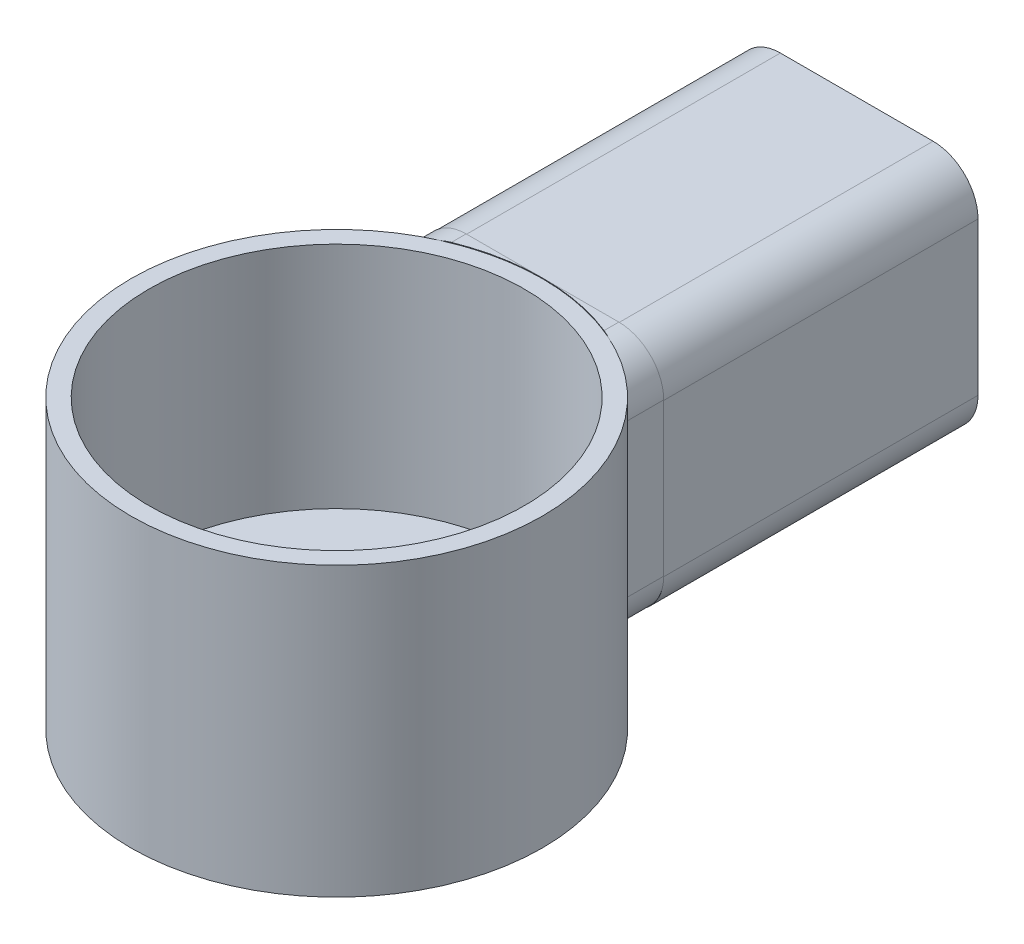
from build123d import *

# Parameters (mm, degrees)
BOSS_EXTRU_1_DEPTH      = 25
BOSS_EXTRU_2_DEPTH      = 10
ESQUISSE4_R             = 22.9
BOSS_EXTRU_3_DEPTH      = 32
BOSS_EXTRU_5_REACH      = 56.445
BOSS_EXTRU_5_END_RADIUS = 22.9
ESQUISSE6_R             = 20.9
ENL_V_MAT_EXTRU_1_DEPTH = 25.5
ESQUISSE8_R             = 2
ENL_V_MAT_EXTRU_3_DEPTH = 2.6
BOSS_EXTRU_6_START      = -25
BOSS_EXTRU_6_DEPTH      = 25


# Read off the part's stored shape, not the designer's step: Boss.-Extru.6
with BuildPart() as part:
    # Esquisse2 → Boss.-Extru.1 (new body)
    with BuildSketch(Plane.XY):
        with BuildLine():
            Line((13.5, 8.5), (13.5, -8.5))
            ThreePointArc((13.5, -8.5), (12.035533906, -12.035533906), (8.5, -13.5))
            Line((8.5, -13.5), (-8.5, -13.5))
            ThreePointArc((-8.5, -13.5), (-12.035533906, -12.035533906), (-13.5, -8.5))
            Line((-13.5, -8.5), (-13.5, 8.5))
            ThreePointArc((-13.5, 8.5), (-12.035533906, 12.035533906), (-8.5, 13.5))
            Line((-8.5, 13.5), (8.5, 13.5))
            ThreePointArc((8.5, 13.5), (12.035533906, 12.035533906), (13.5, 8.5))
        make_face()
        with BuildLine():
            Line((0, 4), (-0.866025404, 4.5))
            Line((-0.866025404, 4.5), (-3.439339828, 4.5))
            Line((-3.439339828, 4.5), (-6, 7.060660172))
            Line((-6, 7.060660172), (-6, 8.5))
            Line((-6, 8.5), (-3, 8.5))
            Line((-3, 8.5), (-3, 9.5))
            Line((-3, 9.5), (-3.5, 9.5))
            Line((-3.5, 9.5), (-3.5, 10))
            Line((-3.5, 10), (-8.5, 10))
            ThreePointArc((-8.5, 10), (-9.560660172, 9.560660172), (-10, 8.5))
            Line((-10, 8.5), (-10, 3.5))
            Line((-10, 3.5), (-9.5, 3.5))
            Line((-9.5, 3.5), (-9.5, 3))
            Line((-9.5, 3), (-8.5, 3))
            Line((-8.5, 3), (-8.5, 6))
            Line((-8.5, 6), (-7.060660172, 6))
            Line((-7.060660172, 6), (-4.5, 3.439339828))
            Line((-4.5, 3.439339828), (-4.5, 0.866025404))
            Line((-4.5, 0.866025404), (-4, 0))
            Line((-4, 0), (-4.5, -0.866025404))
            Line((-4.5, -0.866025404), (-4.5, -3.439339828))
            Line((-4.5, -3.439339828), (-7.060660172, -6))
            Line((-7.060660172, -6), (-8.5, -6))
            Line((-8.5, -6), (-8.5, -3))
            Line((-8.5, -3), (-9.5, -3))
            Line((-9.5, -3), (-9.5, -3.5))
            Line((-9.5, -3.5), (-10, -3.5))
            Line((-10, -3.5), (-10, -8.5))
            ThreePointArc((-10, -8.5), (-9.560660172, -9.560660172), (-8.5, -10))
            Line((-8.5, -10), (-3.5, -10))
            Line((-3.5, -10), (-3.5, -9.5))
            Line((-3.5, -9.5), (-3, -9.5))
            Line((-3, -9.5), (-3, -8.5))
            Line((-3, -8.5), (-6, -8.5))
            Line((-6, -8.5), (-6, -7.060660172))
            Line((-6, -7.060660172), (-3.439339828, -4.5))
            Line((-3.439339828, -4.5), (-0.866025404, -4.5))
            Line((-0.866025404, -4.5), (0, -4))
            Line((0, -4), (0.866025404, -4.5))
            Line((0.866025404, -4.5), (3.439339828, -4.5))
            Line((3.439339828, -4.5), (6, -7.060660172))
            Line((6, -7.060660172), (6, -8.5))
            Line((6, -8.5), (3, -8.5))
            Line((3, -8.5), (3, -9.5))
            Line((3, -9.5), (3.5, -9.5))
            Line((3.5, -9.5), (3.5, -10))
            Line((3.5, -10), (8.5, -10))
            ThreePointArc((8.5, -10), (9.560660172, -9.560660172), (10, -8.5))
            Line((10, -8.5), (10, -3.5))
            Line((10, -3.5), (9.5, -3.5))
            Line((9.5, -3.5), (9.5, -3))
            Line((9.5, -3), (8.5, -3))
            Line((8.5, -3), (8.5, -6))
            Line((8.5, -6), (7.060660172, -6))
            Line((7.060660172, -6), (4.5, -3.439339828))
            Line((4.5, -3.439339828), (4.5, -0.866025404))
            Line((4.5, -0.866025404), (4, 0))
            Line((4, 0), (4.5, 0.866025404))
            Line((4.5, 0.866025404), (4.5, 3.439339828))
            Line((4.5, 3.439339828), (7.060660172, 6))
            Line((7.060660172, 6), (8.5, 6))
            Line((8.5, 6), (8.5, 3))
            Line((8.5, 3), (9.5, 3))
            Line((9.5, 3), (9.5, 3.5))
            Line((9.5, 3.5), (10, 3.5))
            Line((10, 3.5), (10, 8.5))
            ThreePointArc((10, 8.5), (9.560660172, 9.560660172), (8.5, 10))
            Line((8.5, 10), (3.5, 10))
            Line((3.5, 10), (3.5, 9.5))
            Line((3.5, 9.5), (3, 9.5))
            Line((3, 9.5), (3, 8.5))
            Line((3, 8.5), (6, 8.5))
            Line((6, 8.5), (6, 7.060660172))
            Line((6, 7.060660172), (3.439339828, 4.5))
            Line((3.439339828, 4.5), (0.866025404, 4.5))
            Line((0.866025404, 4.5), (0, 4))
        make_face(mode=Mode.SUBTRACT)
    extrude(amount=BOSS_EXTRU_1_DEPTH)

    # Esquisse3 → Boss.-Extru.2 (add)
    with BuildSketch(Plane.XY.offset(25)):
        with BuildLine():
            Line((-8.5, 13.5), (8.5, 13.5))
            ThreePointArc((8.5, 13.5), (12.035533906, 12.035533906), (13.5, 8.5))
            Line((13.5, 8.5), (13.5, -8.5))
            ThreePointArc((13.5, -8.5), (12.035533906, -12.035533906), (8.5, -13.5))
            Line((8.5, -13.5), (-8.5, -13.5))
            ThreePointArc((-8.5, -13.5), (-12.035533906, -12.035533906), (-13.5, -8.5))
            Line((-13.5, -8.5), (-13.5, 8.5))
            ThreePointArc((-13.5, 8.5), (-12.035533906, 12.035533906), (-8.5, 13.5))
        make_face()
    extrude(amount=BOSS_EXTRU_2_DEPTH)

    # Boss.-Extru.6 outline → Boss.-Extru.6 (add)
    with BuildSketch(Plane(origin=(0, 0, 0), x_dir=(-1, 0, 0), z_dir=(0, 0, -1)).offset(BOSS_EXTRU_6_START)):
        with BuildLine():
            Line((-1.273167982, 2.43752811), (-1.947287092, 3.003181207))
            Line((-1.947287092, 3.003181207), (-3.000876196, 1.949592103))
            Line((-3.000876196, 1.949592103), (-2.435900169, 1.276279893))
            ThreePointArc((-2.435900169, 1.276279893), (-2.749999439, 0.001756003), (-2.43752811, -1.273167982))
            Line((-2.43752811, -1.273167982), (-3.003181207, -1.947287092))
            Line((-3.003181207, -1.947287092), (-1.949592103, -3.000876196))
            Line((-1.949592103, -3.000876196), (-1.276279893, -2.435900169))
            ThreePointArc((-1.276279893, -2.435900169), (-0.001756003, -2.749999439), (1.273167982, -2.43752811))
            Line((1.273167982, -2.43752811), (1.947287092, -3.003181207))
            Line((1.947287092, -3.003181207), (3.000876196, -1.949592103))
            Line((3.000876196, -1.949592103), (2.435900169, -1.276279893))
            ThreePointArc((2.435900169, -1.276279893), (2.749999439, -0.001756003), (2.43752811, 1.273167982))
            Line((2.43752811, 1.273167982), (3.003181207, 1.947287092))
            Line((3.003181207, 1.947287092), (1.949592103, 3.000876196))
            Line((1.949592103, 3.000876196), (1.276279893, 2.435900169))
            ThreePointArc((1.276279893, 2.435900169), (0.001756003, 2.749999439), (-1.273167982, 2.43752811))
        make_face()
    extrude(amount=BOSS_EXTRU_6_DEPTH)


with BuildPart() as body_2:
    # Esquisse4 → Boss.-Extru.3 (new body)
    with BuildSketch(Plane(origin=(0, 13.5, 0), x_dir=(1, 0, 0), z_dir=(0, 1, 0))):
        with Locations(Location((0, -57.9, 0), (0, 0, 180))):
            Circle(ESQUISSE4_R)
    extrude(amount=-BOSS_EXTRU_3_DEPTH)

    # Esquisse6 → Enlèv. mat.-Extru.1 (cut)
    with BuildSketch(Plane(origin=(0, 13.5, 0), x_dir=(1, 0, 0), z_dir=(0, 1, 0))):
        with Locations(Location((0, -57.9, 0), (0, 0, 180))):
            Circle(ESQUISSE6_R)
    extrude(amount=-ENL_V_MAT_EXTRU_1_DEPTH, mode=Mode.SUBTRACT)

    # Esquisse8 → Enlèv. mat.-Extru.3 (cut)
    with BuildSketch(Plane(origin=(0, -12, 0), x_dir=(1, 0, 0), z_dir=(0, 1, 0))):
        with Locations(Location((0, -57.9, 0), (0, 0, 180))):
            Circle(ESQUISSE8_R)
    extrude(amount=-ENL_V_MAT_EXTRU_3_DEPTH, mode=Mode.SUBTRACT)


with BuildPart() as body_3:
    # Boss.-Extru.5: up to this cylinder (the profile starts outside it)
    boss_extru_5_end = Plane(origin=(0, 0.068098, 57.9), z_dir=(0, 1, 0)) * Cylinder(BOSS_EXTRU_5_END_RADIUS, 159.69, mode=Mode.PRIVATE)
    # Esquisse5 → Boss.-Extru.5 (new, up to the surface)
    with BuildSketch(Plane.XY.offset(35), mode=Mode.PRIVATE) as boss_extru_5_sk1:
        with BuildLine():
            Line((-8.486380485, 13.568097576), (8.513619515, 13.568097576))
            ThreePointArc((8.513619515, 13.568097576), (12.049153421, 12.103631482), (13.513619515, 8.568097576))
            Line((13.513619515, 8.568097576), (13.513619515, -8.431902424))
            ThreePointArc((13.513619515, -8.431902424), (12.049153421, -11.96743633), (8.513619515, -13.431902424))
            Line((8.513619515, -13.431902424), (-8.486380485, -13.431902424))
            ThreePointArc((-8.486380485, -13.431902424), (-12.021914391, -11.96743633), (-13.486380485, -8.431902424))
            Line((-13.486380485, -8.431902424), (-13.486380485, 8.568097576))
            ThreePointArc((-13.486380485, 8.568097576), (-12.021914391, 12.103631482), (-8.486380485, 13.568097576))
        make_face()
    boss_extru_5_tool1 = extrude(boss_extru_5_sk1.sketch, amount=BOSS_EXTRU_5_REACH, mode=Mode.PRIVATE) - boss_extru_5_end
    add(boss_extru_5_tool1.solids().sort_by_distance((0.01362, 0.068098, 35))[0])
    add(boss_extru_5_tool1.solids().sort_by_distance((0.01362, 0.068098, 35))[1])


solid = Compound([part.part, body_2.part, body_3.part])
